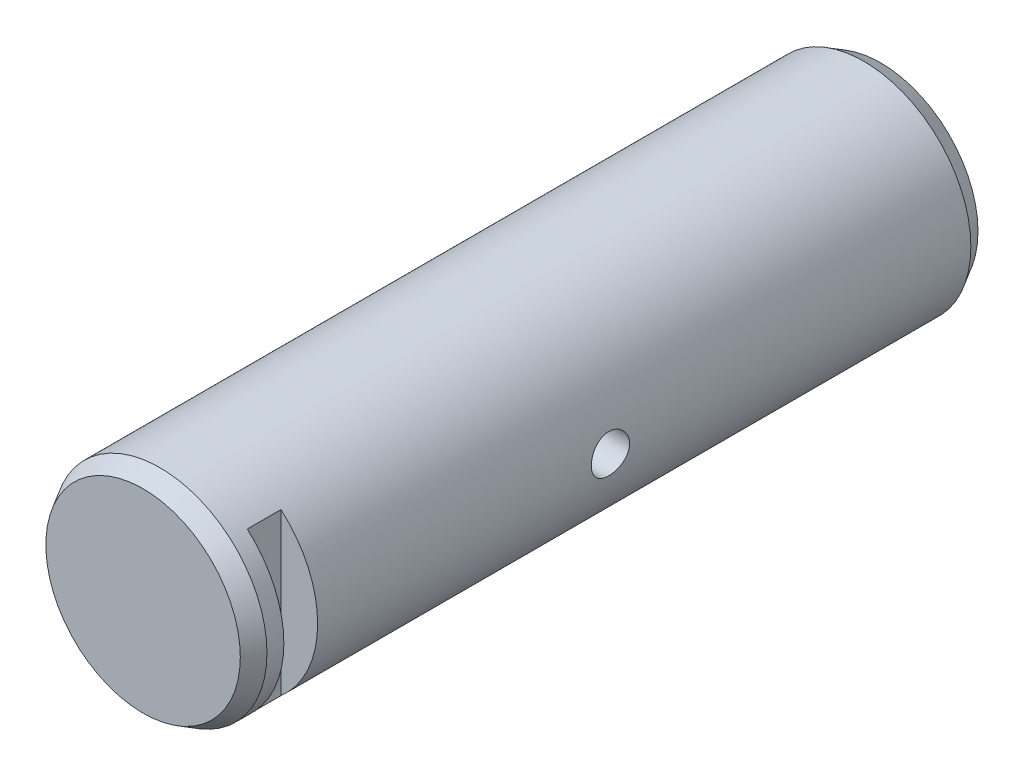
from build123d import *
from OCP.BRepFilletAPI import BRepFilletAPI_MakeChamfer

# Parameters (mm, degrees)
AUFSATZ_LINEAR_AUSTRAGEN1_DEPTH      = 75
AUFSATZ_LINEAR_AUSTRAGEN1_DEPTH_BACK = 56
SKIZZE1_R                            = 19
M8_GEWINDEBOHRUNG1_D                 = 6.8
M8_GEWINDEBOHRUNG1_DEPTH             = 75
M8_GEWINDEBOHRUNG1_TIP               = 2.042926105
SKIZZE7_W                            = 3.4
SKIZZE7_H                            = 19
SCHNITT_LINEAR_AUSTRAGEN1_DEPTH      = 80.668061496
SCHNITT_LINEAR_AUSTRAGEN1_DEPTH_BACK = 80.668061496
SKIZZE8_W                            = 6.5
SKIZZE8_H                            = 6
FASE1_SIZE                           = 3
FASE1_SIZE2                          = 1.732050808


with BuildPart() as part:
    # Skizze1 → Aufsatz-Linear austragen1 (new, two sides: drawn at the far end of the back side and taken through both)
    with BuildSketch(Plane.XY.offset(-AUFSATZ_LINEAR_AUSTRAGEN1_DEPTH_BACK)):
        Circle(SKIZZE1_R)
    extrude(amount=AUFSATZ_LINEAR_AUSTRAGEN1_DEPTH + AUFSATZ_LINEAR_AUSTRAGEN1_DEPTH_BACK)

    # M8 Gewindebohrung1
    with Locations(Plane(origin=(0, 0, -56), x_dir=(-1, 0, 0), z_dir=(0, 0, -1))):
        with Locations((0, 0)):
            Hole(M8_GEWINDEBOHRUNG1_D / 2, depth=M8_GEWINDEBOHRUNG1_DEPTH)
            with Locations((0, 0, -(M8_GEWINDEBOHRUNG1_DEPTH + M8_GEWINDEBOHRUNG1_TIP / 2))):  # 118° drill point
                Cone(0, M8_GEWINDEBOHRUNG1_D / 2, M8_GEWINDEBOHRUNG1_TIP, mode=Mode.SUBTRACT)

    # Skizze7 → Kernloch für M8 Gewinde1 (revolve, cut)
    with BuildSketch(Plane(origin=(0, 0, 11), x_dir=(0, 0, 1), z_dir=(0, 1, 0))):
        with Locations((1.7, 9.5)):
            Rectangle(SKIZZE7_W, SKIZZE7_H)
    revolve(axis=Axis((-6.35, 0, 11), (1, 0, 0)), mode=Mode.SUBTRACT)

    # Skizze8 → Schnitt-Linear austragen1 (cut, two sides: drawn at the far end of the back side and taken through both)
    with BuildSketch(Plane(origin=(0, 0, 0), x_dir=(1, 0, 0), z_dir=(0, 1, 0)).offset(-SCHNITT_LINEAR_AUSTRAGEN1_DEPTH_BACK)):
        with Locations((15.75, -66)):
            Rectangle(SKIZZE8_W, SKIZZE8_H)
    extrude(amount=SCHNITT_LINEAR_AUSTRAGEN1_DEPTH + SCHNITT_LINEAR_AUSTRAGEN1_DEPTH_BACK, mode=Mode.SUBTRACT)

    # Fase1: one chamfer whose edges measure the first distance from different faces: ONE call of the kernel's chamfer builder (chamfer() names one face for all edges)
    fase1_edges_1 = [part.edges().sort_by_distance(p)[0] for p in [
        (-19, 0, -56),
    ]]
    fase1_side_1 = [part.faces().sort_by_distance(p)[0] for p in [
        (-19, 0, -28),
    ]]
    fase1_edges_2 = [part.edges().sort_by_distance(p)[0] for p in [
        (-19, 0, 75),
    ]]
    fase1_side_2 = [part.faces().sort_by_distance(p)[0] for p in [
        (-19, 0, 37.5),
    ]]
    fase1 = BRepFilletAPI_MakeChamfer(part.part.solid().wrapped)
    for e in fase1_edges_1:
        fase1.Add(FASE1_SIZE, FASE1_SIZE2, e.wrapped, fase1_side_1[0].wrapped)  # the first distance lies on this face
    for e in fase1_edges_2:
        fase1.Add(FASE1_SIZE, FASE1_SIZE2, e.wrapped, fase1_side_2[0].wrapped)  # the first distance lies on this face
    add(Compound.cast(fase1.Shape()), mode=Mode.REPLACE)


solid = part.part
